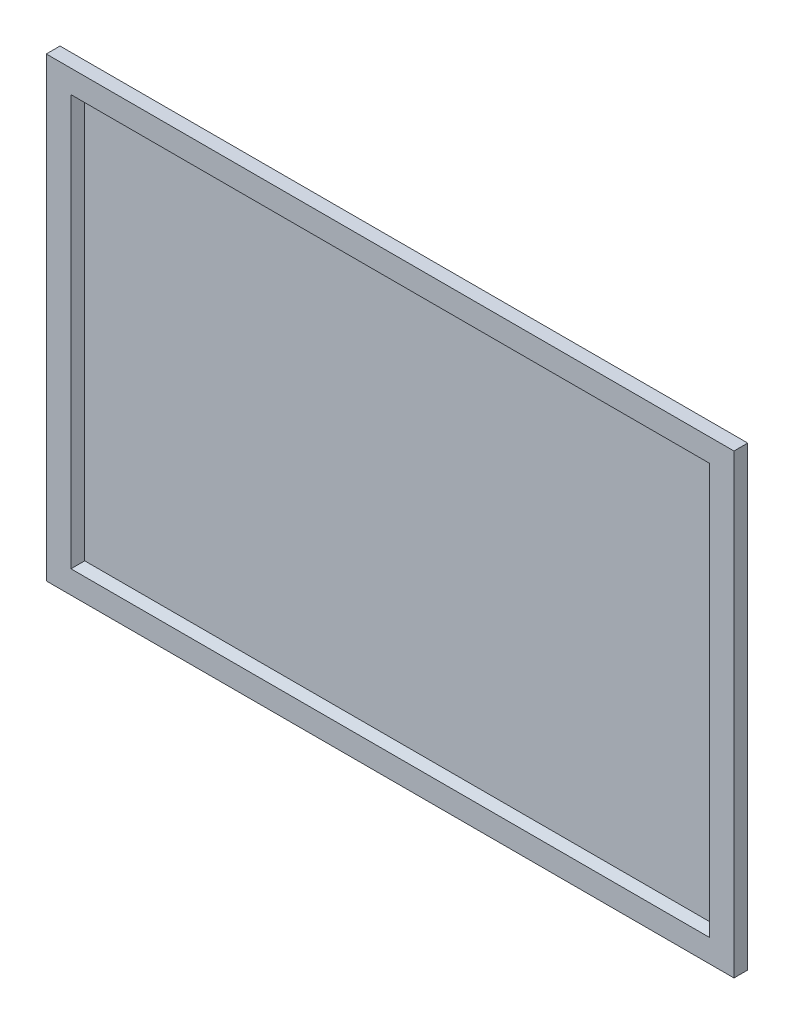
from build123d import *

# Parameters (mm, degrees)
SKETCH2_W           = 1000
SKETCH2_H           = 663.636363636
BOSS_EXTRUDE1_DEPTH = 20
SKETCH3_W           = 948.152188742
SKETCH3_H           = 617.123435666
CUT_EXTRUDE1_DEPTH  = 10
CHAMFER1_SIZE       = 20


with BuildPart() as part:
    # Sketch2 → Boss-Extrude1 (new body)
    with BuildSketch(Plane.XY):
        Rectangle(SKETCH2_W, SKETCH2_H)
    extrude(amount=BOSS_EXTRUDE1_DEPTH)

    # Sketch3 → Cut-Extrude1 (cut)
    with BuildSketch(Plane.XY.offset(20)):
        Rectangle(SKETCH3_W, SKETCH3_H)
    extrude(amount=-CUT_EXTRUDE1_DEPTH, mode=Mode.SUBTRACT)

    # Chamfer1
    # the kernel refuses this chamfer: 20 mm, written as the material it adds along each edge
    with BuildSketch(Plane(origin=(-474.076094371, -308.561717833, 10), x_dir=(0, -0.0274958766105877, 0.9996219169112968), z_dir=(1, 0, 0))) as chamfer1_piece_1_section:
        Polygon((CHAMFER1_SIZE * 0.999621916911, -CHAMFER1_SIZE * 0.0274958766106), (-CHAMFER1_SIZE * 0.0274958766106, -CHAMFER1_SIZE * 0.999621916911), (0, 0), align=None)
    chamfer1_piece_1 = extrude(amount=948.152188741, mode=Mode.PRIVATE)
    chamfer1_piece_1 = split(chamfer1_piece_1, bisect_by=Plane(origin=(0, -300.783940055, 20), z_dir=(0, 0, -1)), keep=Keep.TOP, mode=Mode.PRIVATE)
    add(chamfer1_piece_1)
    with BuildSketch(Plane(origin=(-474.076094371, 308.561717833, 10), x_dir=(-0.0274958766105877, 0, 0.9996219169112968), z_dir=(0, -1, 0))) as chamfer1_piece_2_section:
        Polygon((CHAMFER1_SIZE * 0.999621916911, -CHAMFER1_SIZE * 0.0274958766106), (-CHAMFER1_SIZE * 0.0274958766106, -CHAMFER1_SIZE * 0.999621916911), (0, 0), align=None)
    chamfer1_piece_2 = extrude(amount=617.123435666, mode=Mode.PRIVATE)
    chamfer1_piece_2 = split(chamfer1_piece_2, bisect_by=Plane(origin=(-466.298316593, 0, 20), z_dir=(0, 0, -1)), keep=Keep.TOP, mode=Mode.PRIVATE)
    add(chamfer1_piece_2)
    with BuildSketch(Plane(origin=(474.076094371, 308.561717833, 10), x_dir=(0, 0.0274958766105877, 0.9996219169112968), z_dir=(-1, 0, 0))) as chamfer1_piece_3_section:
        Polygon((CHAMFER1_SIZE * 0.999621916911, -CHAMFER1_SIZE * 0.0274958766106), (-CHAMFER1_SIZE * 0.0274958766106, -CHAMFER1_SIZE * 0.999621916911), (0, 0), align=None)
    chamfer1_piece_3 = extrude(amount=948.152188741, mode=Mode.PRIVATE)
    chamfer1_piece_3 = split(chamfer1_piece_3, bisect_by=Plane(origin=(0, 300.783940055, 20), z_dir=(0, 0, -1)), keep=Keep.TOP, mode=Mode.PRIVATE)
    add(chamfer1_piece_3)
    with BuildSketch(Plane(origin=(474.076094371, -308.561717833, 10), x_dir=(0.0274958766105877, 0, 0.9996219169112968), z_dir=(0, 1, 0))) as chamfer1_piece_4_section:
        Polygon((CHAMFER1_SIZE * 0.999621916911, -CHAMFER1_SIZE * 0.0274958766106), (-CHAMFER1_SIZE * 0.0274958766106, -CHAMFER1_SIZE * 0.999621916911), (0, 0), align=None)
    chamfer1_piece_4 = extrude(amount=617.123435666, mode=Mode.PRIVATE)
    chamfer1_piece_4 = split(chamfer1_piece_4, bisect_by=Plane(origin=(466.298316593, 0, 20), z_dir=(0, 0, -1)), keep=Keep.TOP, mode=Mode.PRIVATE)
    add(chamfer1_piece_4)


solid = part.part
